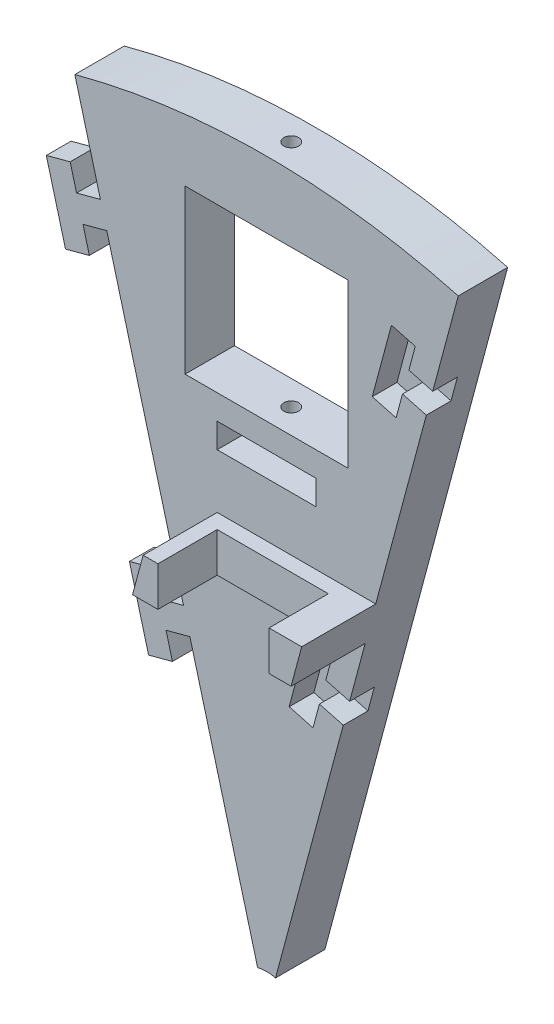
from build123d import *

# Parameters (mm, degrees)
SKETCH1_R           = 150
SKETCH1_W           = 33
SKETCH1_H           = 33
BOSS_EXTRUDE1_DEPTH = 5
SKETCH4_R           = 1.5
CUT_EXTRUDE1_DEPTH  = 55
CIRPATTERN1_COUNT   = 12
CUT_EXTRUDE2_REACH  = 214.368
SKETCH5_W           = 20
SKETCH5_H           = 5
SKETCH5_W_2         = 5
SKETCH5_H_2         = 20
CUT_EXTRUDE3_DEPTH  = 10
BOSS_EXTRUDE2_DEPTH = 5
CUT_EXTRUDE4_DEPTH  = 5
BOSS_EXTRUDE3_DEPTH = 15
SKETCH11_W          = 22.5
SKETCH11_H          = 8
BOSS_EXTRUDE4_DEPTH = 3


with BuildPart() as part:
    # Sketch1 → Boss-Extrude1 (new, symmetric)
    with BuildSketch(Plane.XY):
        Circle(SKETCH1_R)
        Polygon((37.460580838, 97.883629292), (66.039419162, 81.383629292), (82.539419162, 109.962467617), (53.960580838, 126.462467617), align=None, mode=Mode.SUBTRACT)
        with Locations((0, 120)):
            Rectangle(SKETCH1_W, SKETCH1_H, mode=Mode.SUBTRACT)
        Polygon((81.383629292, 66.039419162), (97.883629292, 37.460580838), (126.462467617, 53.960580838), (109.962467617, 82.539419162), align=None, mode=Mode.SUBTRACT)
        with Locations((120, 0)):
            Rectangle(SKETCH1_W, SKETCH1_H, mode=Mode.SUBTRACT)
        Polygon((97.883629292, -37.460580838), (81.383629292, -66.039419162), (109.962467617, -82.539419162), (126.462467617, -53.960580838), align=None, mode=Mode.SUBTRACT)
        Polygon((66.039419162, -81.383629292), (37.460580838, -97.883629292), (53.960580838, -126.462467617), (82.539419162, -109.962467617), align=None, mode=Mode.SUBTRACT)
        with Locations((0, -120)):
            Rectangle(SKETCH1_W, SKETCH1_H, mode=Mode.SUBTRACT)
        Polygon((-37.460580838, -97.883629292), (-66.039419162, -81.383629292), (-82.539419162, -109.962467617), (-53.960580838, -126.462467617), align=None, mode=Mode.SUBTRACT)
        Polygon((-81.383629292, -66.039419162), (-97.883629292, -37.460580838), (-126.462467617, -53.960580838), (-109.962467617, -82.539419162), align=None, mode=Mode.SUBTRACT)
        with Locations((-120, 0)):
            Rectangle(SKETCH1_W, SKETCH1_H, mode=Mode.SUBTRACT)
        Polygon((-97.883629292, 37.460580838), (-81.383629292, 66.039419162), (-109.962467617, 82.539419162), (-126.462467617, 53.960580838), align=None, mode=Mode.SUBTRACT)
        Polygon((-66.039419162, 81.383629292), (-37.460580838, 97.883629292), (-53.960580838, 126.462467617), (-82.539419162, 109.962467617), align=None, mode=Mode.SUBTRACT)
    extrude(amount=BOSS_EXTRUDE1_DEPTH, both=True)

    # Sketch4 → Cut-Extrude1 (cut)
    with BuildSketch(Plane(origin=(0, -150, 0), x_dir=(-1, 0, 0), z_dir=(0, -1, 0))):
        Circle(SKETCH4_R)
    cut_extrude1 = extrude(amount=-CUT_EXTRUDE1_DEPTH, mode=Mode.SUBTRACT)

    # CirPattern1: Cut-Extrude1 ×12 about axis
    cirpattern1_axis = Axis((0, 0, 5), (0, 0, -1))
    for i in range(1, CIRPATTERN1_COUNT):
        add(cut_extrude1.rotate(cirpattern1_axis, i * 360 / CIRPATTERN1_COUNT), mode=Mode.SUBTRACT)

    # Sketch5 → Cut-Extrude2 (cut, up to next)
    with BuildSketch(Plane(origin=(0, 0, -5), x_dir=(-1, 0, 0), z_dir=(0, 0, -1)), mode=Mode.PRIVATE) as cut_extrude2_sk1:
        Polygon((38.089745962, 85.973375254), (55.410254038, 75.973375254), (57.910254038, 80.303502273), (40.589745962, 90.303502273), align=None)
    cut_extrude2_tool1 = extrude(cut_extrude2_sk1.sketch, amount=-CUT_EXTRUDE2_REACH, mode=Mode.PRIVATE) & part.part
    # Sketch5 → Cut-Extrude2 (cut, up to next)
    with BuildSketch(Plane(origin=(0, 0, -5), x_dir=(-1, 0, 0), z_dir=(0, 0, -1)), mode=Mode.PRIVATE) as cut_extrude2_sk2:
        with Locations((0, 96)):
            Rectangle(SKETCH5_W, SKETCH5_H)
    cut_extrude2_tool2 = extrude(cut_extrude2_sk2.sketch, amount=-CUT_EXTRUDE2_REACH, mode=Mode.PRIVATE) & part.part
    # Sketch5 → Cut-Extrude2 (cut, up to next)
    with BuildSketch(Plane(origin=(0, 0, -5), x_dir=(-1, 0, 0), z_dir=(0, 0, -1)), mode=Mode.PRIVATE) as cut_extrude2_sk3:
        Polygon((75.973375254, 55.410254038), (85.973375254, 38.089745962), (90.303502273, 40.589745962), (80.303502273, 57.910254038), align=None)
    cut_extrude2_tool3 = extrude(cut_extrude2_sk3.sketch, amount=-CUT_EXTRUDE2_REACH, mode=Mode.PRIVATE) & part.part
    # Sketch5 → Cut-Extrude2 (cut, up to next)
    with BuildSketch(Plane(origin=(0, 0, -5), x_dir=(-1, 0, 0), z_dir=(0, 0, -1)), mode=Mode.PRIVATE) as cut_extrude2_sk4:
        with Locations((96, 0)):
            Rectangle(SKETCH5_W_2, SKETCH5_H_2)
    cut_extrude2_tool4 = extrude(cut_extrude2_sk4.sketch, amount=-CUT_EXTRUDE2_REACH, mode=Mode.PRIVATE) & part.part
    # Sketch5 → Cut-Extrude2 (cut, up to next)
    with BuildSketch(Plane(origin=(0, 0, -5), x_dir=(-1, 0, 0), z_dir=(0, 0, -1)), mode=Mode.PRIVATE) as cut_extrude2_sk5:
        Polygon((85.973375254, -38.089745962), (75.973375254, -55.410254038), (80.303502273, -57.910254038), (90.303502273, -40.589745962), align=None)
    cut_extrude2_tool5 = extrude(cut_extrude2_sk5.sketch, amount=-CUT_EXTRUDE2_REACH, mode=Mode.PRIVATE) & part.part
    # Sketch5 → Cut-Extrude2 (cut, up to next)
    with BuildSketch(Plane(origin=(0, 0, -5), x_dir=(-1, 0, 0), z_dir=(0, 0, -1)), mode=Mode.PRIVATE) as cut_extrude2_sk6:
        Polygon((55.410254038, -75.973375254), (38.089745962, -85.973375254), (40.589745962, -90.303502273), (57.910254038, -80.303502273), align=None)
    cut_extrude2_tool6 = extrude(cut_extrude2_sk6.sketch, amount=-CUT_EXTRUDE2_REACH, mode=Mode.PRIVATE) & part.part
    # Sketch5 → Cut-Extrude2 (cut, up to next)
    with BuildSketch(Plane(origin=(0, 0, -5), x_dir=(-1, 0, 0), z_dir=(0, 0, -1)), mode=Mode.PRIVATE) as cut_extrude2_sk7:
        with Locations((0, -96)):
            Rectangle(SKETCH5_W, SKETCH5_H)
    cut_extrude2_tool7 = extrude(cut_extrude2_sk7.sketch, amount=-CUT_EXTRUDE2_REACH, mode=Mode.PRIVATE) & part.part
    # Sketch5 → Cut-Extrude2 (cut, up to next)
    with BuildSketch(Plane(origin=(0, 0, -5), x_dir=(-1, 0, 0), z_dir=(0, 0, -1)), mode=Mode.PRIVATE) as cut_extrude2_sk8:
        Polygon((-38.089745962, -85.973375254), (-55.410254038, -75.973375254), (-57.910254038, -80.303502273), (-40.589745962, -90.303502273), align=None)
    cut_extrude2_tool8 = extrude(cut_extrude2_sk8.sketch, amount=-CUT_EXTRUDE2_REACH, mode=Mode.PRIVATE) & part.part
    # Sketch5 → Cut-Extrude2 (cut, up to next)
    with BuildSketch(Plane(origin=(0, 0, -5), x_dir=(-1, 0, 0), z_dir=(0, 0, -1)), mode=Mode.PRIVATE) as cut_extrude2_sk9:
        Polygon((-75.973375254, -55.410254038), (-85.973375254, -38.089745962), (-90.303502273, -40.589745962), (-80.303502273, -57.910254038), align=None)
    cut_extrude2_tool9 = extrude(cut_extrude2_sk9.sketch, amount=-CUT_EXTRUDE2_REACH, mode=Mode.PRIVATE) & part.part
    # Sketch5 → Cut-Extrude2 (cut, up to next)
    with BuildSketch(Plane(origin=(0, 0, -5), x_dir=(-1, 0, 0), z_dir=(0, 0, -1)), mode=Mode.PRIVATE) as cut_extrude2_sk10:
        with Locations((-96, 0)):
            Rectangle(SKETCH5_W_2, SKETCH5_H_2)
    cut_extrude2_tool10 = extrude(cut_extrude2_sk10.sketch, amount=-CUT_EXTRUDE2_REACH, mode=Mode.PRIVATE) & part.part
    # Sketch5 → Cut-Extrude2 (cut, up to next)
    with BuildSketch(Plane(origin=(0, 0, -5), x_dir=(-1, 0, 0), z_dir=(0, 0, -1)), mode=Mode.PRIVATE) as cut_extrude2_sk11:
        Polygon((-85.973375254, 38.089745962), (-75.973375254, 55.410254038), (-80.303502273, 57.910254038), (-90.303502273, 40.589745962), align=None)
    cut_extrude2_tool11 = extrude(cut_extrude2_sk11.sketch, amount=-CUT_EXTRUDE2_REACH, mode=Mode.PRIVATE) & part.part
    # Sketch5 → Cut-Extrude2 (cut, up to next)
    with BuildSketch(Plane(origin=(0, 0, -5), x_dir=(-1, 0, 0), z_dir=(0, 0, -1)), mode=Mode.PRIVATE) as cut_extrude2_sk12:
        Polygon((-55.410254038, 75.973375254), (-38.089745962, 85.973375254), (-40.589745962, 90.303502273), (-57.910254038, 80.303502273), align=None)
    cut_extrude2_tool12 = extrude(cut_extrude2_sk12.sketch, amount=-CUT_EXTRUDE2_REACH, mode=Mode.PRIVATE) & part.part
    add(cut_extrude2_tool1.solids().sort_by_distance((-48, 83.138439, -5))[0], mode=Mode.SUBTRACT)
    add(cut_extrude2_tool2.solids().sort_by_distance((0, 96, -5))[0], mode=Mode.SUBTRACT)
    add(cut_extrude2_tool3.solids().sort_by_distance((-83.138439, 48, -5))[0], mode=Mode.SUBTRACT)
    add(cut_extrude2_tool4.solids().sort_by_distance((-96, 0, -5))[0], mode=Mode.SUBTRACT)
    add(cut_extrude2_tool5.solids().sort_by_distance((-83.138439, -48, -5))[0], mode=Mode.SUBTRACT)
    add(cut_extrude2_tool6.solids().sort_by_distance((-48, -83.138439, -5))[0], mode=Mode.SUBTRACT)
    add(cut_extrude2_tool7.solids().sort_by_distance((0, -96, -5))[0], mode=Mode.SUBTRACT)
    add(cut_extrude2_tool8.solids().sort_by_distance((48, -83.138439, -5))[0], mode=Mode.SUBTRACT)
    add(cut_extrude2_tool9.solids().sort_by_distance((83.138439, -48, -5))[0], mode=Mode.SUBTRACT)
    add(cut_extrude2_tool10.solids().sort_by_distance((96, 0, -5))[0], mode=Mode.SUBTRACT)
    add(cut_extrude2_tool11.solids().sort_by_distance((83.138439, 48, -5))[0], mode=Mode.SUBTRACT)
    add(cut_extrude2_tool12.solids().sort_by_distance((48, 83.138439, -5))[0], mode=Mode.SUBTRACT)

    # Sketch6 → Cut-Extrude3 (cut)
    with BuildSketch(Plane.XY.offset(5)):
        with BuildLine():
            Line((38.822856765, 144.888873943), (1.811733316, 6.761480784))
            ThreePointArc((1.811733316, 6.761480784), (0, 7), (-1.811733316, 6.761480784))
            Line((-1.811733316, 6.761480784), (-38.822856765, 144.888873943))
            ThreePointArc((-38.822856765, 144.888873943), (0, -150), (38.822856765, 144.888873943))
        make_face()
    extrude(amount=-CUT_EXTRUDE3_DEPTH, mode=Mode.SUBTRACT)

    # Sketch7 → Boss-Extrude2 (add)
    with BuildSketch(Plane.XY.offset(5)):
        Polygon((-20.358771838, 56.661454352), (-15.529142706, 57.955549577), (-16.823237932, 62.785178709), (-21.652867063, 61.491083483), (-22.946962289, 66.320712615), (-27.77659142, 65.026617389), (-23.894305744, 50.537729995), (-19.064676612, 51.83182522), align=None)
        Polygon((-37.182009769, 119.446633061), (-32.352380638, 120.740728286), (-33.646475863, 125.570357418), (-38.476104995, 124.276262192), (-39.77020022, 129.105891324), (-44.599829352, 127.811796098), (-40.717543675, 113.322908704), (-35.887914544, 114.617003929), align=None)
    extrude(amount=-BOSS_EXTRUDE2_DEPTH)

    # Sketch9 → Cut-Extrude4 (cut)
    with BuildSketch(Plane.XY.offset(5)):
        Polygon((32.352380638, 120.740728286), (33.646475863, 125.570357418), (28.816846732, 126.864452643), (30.110941957, 131.694081775), (25.281312826, 132.988177), (21.399027149, 118.499289606), (26.228656281, 117.20519438), (27.522751506, 122.034823512), align=None)
        Polygon((15.529142706, 57.955549577), (16.823237932, 62.785178709), (11.9936088, 64.079273934), (13.287704026, 68.908903066), (8.458074894, 70.202998291), (4.575789218, 55.714110897), (9.405418349, 54.420015671), (10.699513575, 59.249644803), align=None)
    extrude(amount=-CUT_EXTRUDE4_DEPTH, mode=Mode.SUBTRACT)

    # Sketch10 → Boss-Extrude3 (add)
    with BuildSketch(Plane.XY.offset(5)):
        Polygon((-7, 82.5), (-10, 82.5), (-12.143593539, 74.5), (-7, 74.5), align=None)
        Polygon((22.105808376, 82.5), (15.5, 82.5), (15.5, 74.5), (19.962214836, 74.5), align=None)
    extrude(amount=BOSS_EXTRUDE3_DEPTH)

    # Sketch11 → Boss-Extrude4 (add)
    with BuildSketch(Plane.XY.offset(5)):
        with Locations((4.25, 78.5)):
            Rectangle(SKETCH11_W, SKETCH11_H)
    extrude(amount=BOSS_EXTRUDE4_DEPTH)


solid = part.part
